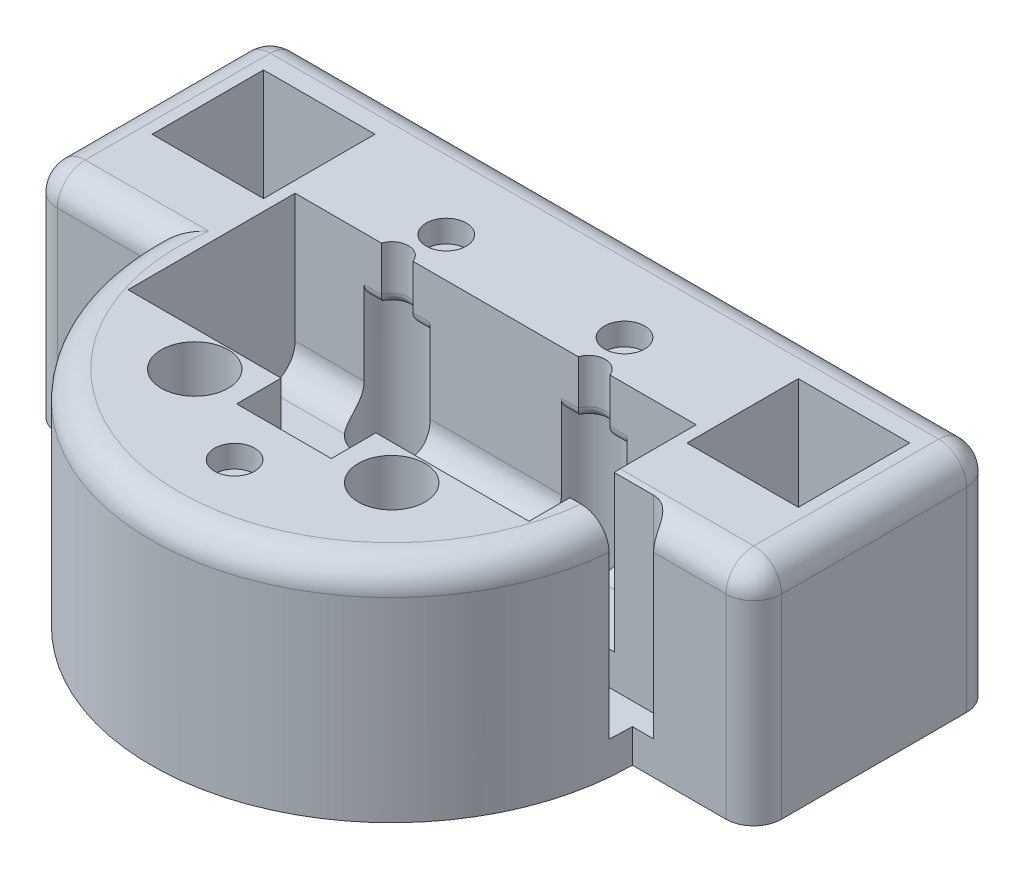
from build123d import *

# Parameters (mm, degrees)
SKETCH1_R           = 43.2
BOSS_EXTRUDE1_DEPTH = 40
SKETCH2_R           = 3
SKETCH2_W           = 20
SKETCH2_H           = 20
CUT_EXTRUDE1_DEPTH  = 50
SKETCH3_W           = 8.5
SKETCH3_H           = 8
SKETCH3_W_2         = 72
SKETCH3_H_2         = 30
CUT_EXTRUDE2_DEPTH  = 28
FILLET1_R           = 5
CUT_EXTRUDE3_START  = -34
SKETCH4_R           = 4
CUT_EXTRUDE3_DEPTH  = 34
SKETCH5_R           = 3.6
CUT_EXTRUDE4_DEPTH  = 4
FILLET3_R           = 5
SKETCH7_R           = 6
CUT_EXTRUDE5_DEPTH  = 36
CUT_EXTRUDE6_START  = -10
SKETCH8_R           = 6
SKETCH8_R_2         = 5.953171137
CUT_EXTRUDE6_DEPTH  = 26
FILLET4_R           = 2


with BuildPart() as part:
    # Sketch1 → Boss-Extrude1 (new body)
    with BuildSketch(Plane(origin=(0, 0, 0), x_dir=(1, 0, 0), z_dir=(0, 1, 0))):
        Circle(SKETCH1_R)
        with BuildLine():
            Line((0, 43.2), (-65, 43.2))
            Line((-65, 43.2), (-65, 0))
            Line((-65, 0), (-43.2, 0))
            ThreePointArc((-43.2, 0), (-30.547012947, 30.547012947), (0, 43.2))
        make_face()
        with BuildLine():
            Line((65, 43.2), (0, 43.2))
            ThreePointArc((0, 43.2), (30.547012947, 30.547012947), (43.2, 0))
            Line((43.2, 0), (65, 0))
            Line((65, 0), (65, 43.2))
        make_face()
    extrude(amount=BOSS_EXTRUDE1_DEPTH)

    # Sketch2 → Cut-Extrude1 (cut)
    with BuildSketch(Plane(origin=(0, 40, 0), x_dir=(1, 0, 0), z_dir=(0, 1, 0))):
        with Locations(Location((17.67766953, 17.67766953, 0), (0, 0, 270))):
            Circle(SKETCH2_R)
        with Locations(Location((17.67766953, -17.67766953, 0), (0, 0, 270))):
            Circle(SKETCH2_R)
        with Locations(Location((-17.67766953, -17.67766953, 0), (0, 0, 270))):
            Circle(SKETCH2_R)
        with Locations(Location((-17.67766953, 17.67766953, 0), (0, 0, 270))):
            Circle(SKETCH2_R)
        with Locations((48, 25)):
            Rectangle(SKETCH2_W, SKETCH2_H)
        with Locations((-48, 25)):
            Rectangle(SKETCH2_W, SKETCH2_H)
    extrude(amount=-CUT_EXTRUDE1_DEPTH, mode=Mode.SUBTRACT)

    # Sketch3 → Cut-Extrude2 (cut)
    with BuildSketch(Plane(origin=(0, 40, 0), x_dir=(1, 0, 0), z_dir=(0, 1, 0))):
        with Locations((4.25, -15.338834765)):
            Rectangle(SKETCH3_W, SKETCH3_H)
        with Locations((-4.25, -15.338834765)):
            Rectangle(SKETCH3_W, SKETCH3_H)
        with Locations((0, 3.661165235)):
            Rectangle(SKETCH3_W_2, SKETCH3_H_2)
    extrude(amount=-CUT_EXTRUDE2_DEPTH, mode=Mode.SUBTRACT)

    # Fillet1
    # the kernel refuses this fillet: 5 mm, written as the material it adds along each edge
    with BuildSketch(Plane(origin=(36, 12, -18.661165235), x_dir=(0, 1, 0), z_dir=(-1, 0, 0))) as fillet1_piece_1_section:
        with BuildLine():
            CenterArc((FILLET1_R, -FILLET1_R), FILLET1_R, 90, 90)
            Line((0, -FILLET1_R), (0, 0))
            Line((0, 0), (FILLET1_R, 0))
        make_face()
    fillet1_piece_1 = extrude(amount=27.988122257, mode=Mode.PRIVATE)
    fillet1_piece_1 = fillet1_piece_1 - Plane(origin=(17.67766953, 13.117889493, -17.67766953), x_dir=(0, 0, 1), z_dir=(0, 1, 0)) * Cylinder(3, 76, mode=Mode.PRIVATE)
    add(fillet1_piece_1)
    with BuildSketch(Plane(origin=(-8.011877743, 12, -18.661165235), x_dir=(0, 1, 0), z_dir=(-1, 0, 0))) as fillet1_piece_2_section:
        with BuildLine():
            CenterArc((FILLET1_R, -FILLET1_R), FILLET1_R, 90, 90)
            Line((0, -FILLET1_R), (0, 0))
            Line((0, 0), (FILLET1_R, 0))
        make_face()
    fillet1_piece_2 = extrude(amount=27.988122257, mode=Mode.PRIVATE)
    fillet1_piece_2 = fillet1_piece_2 - Plane(origin=(-17.67766953, 13.117890299, -17.67766953), x_dir=(0, 0, 1), z_dir=(0, 1, 0)) * Cylinder(3, 76, mode=Mode.PRIVATE)
    add(fillet1_piece_2)
    with BuildSketch(Plane(origin=(27.343461316, 12, -18.661165235), x_dir=(0, 1, 0), z_dir=(-1, 0, 0))) as fillet1_piece_3_section:
        with BuildLine():
            CenterArc((FILLET1_R, -FILLET1_R), FILLET1_R, 90, 90)
            Line((0, -FILLET1_R), (0, 0))
            Line((0, 0), (FILLET1_R, 0))
        make_face()
    fillet1_piece_3 = extrude(amount=54.686922632, mode=Mode.PRIVATE)
    fillet1_piece_3 = fillet1_piece_3 - Plane(origin=(-17.67766953, 13.117473799, -17.67766953), x_dir=(0, 0, 1), z_dir=(0, 1, 0)) * Cylinder(3, 130, mode=Mode.PRIVATE)
    fillet1_piece_3 = fillet1_piece_3 - Plane(origin=(17.67766953, 13.117473799, -17.67766953), x_dir=(0, 0, 1), z_dir=(0, 1, 0)) * Cylinder(3, 130, mode=Mode.PRIVATE)
    add(fillet1_piece_3)
    with BuildSketch(Plane(origin=(-36, 12, 11.338834765), x_dir=(0, 1, 0), z_dir=(1, 0, 0)), Plane(origin=(8.5, 12, 11.338834765), x_dir=(0, 1, 0), z_dir=(1, 0, 0))) as fillet1_piece_4:
        with BuildLine():
            CenterArc((FILLET1_R, -FILLET1_R), FILLET1_R, 90, 90)
            Line((0, -FILLET1_R), (0, 0))
            Line((0, 0), (FILLET1_R, 0))
        make_face()
    extrude(amount=27.5)

    # Sketch4 → Cut-Extrude3 (cut)
    with BuildSketch(Plane(origin=(0, 40, 0), x_dir=(1, 0, 0), z_dir=(0, 1, 0)).offset(CUT_EXTRUDE3_START)):
        with BuildLine():
            Line((43.014416188, 4), (36, 4))
            Line((36, 4), (36, -4))
            Line((36, -4), (43.014416188, -4))
            ThreePointArc((43.014416188, -4), (43.153579106, -2.002151427), (43.2, 0))
            Line((43.2, 0), (47.014416188, 0))
            ThreePointArc((47.014416188, 0), (45.842843313, 2.828427125), (43.014416188, 4))
        make_face()
        with BuildLine():
            Line((36, 4), (23.014416188, 4))
            ThreePointArc((23.014416188, 4), (25.842843313, 2.828427125), (27.014416188, 0))
            ThreePointArc((27.014416188, 0), (25.842843313, -2.828427125), (23.014416188, -4))
            Line((23.014416188, -4), (36, -4))
            Line((36, -4), (36, 4))
        make_face()
        with Locations((23.014416188, 0)):
            Circle(SKETCH4_R)
        with BuildLine():
            ThreePointArc((43.014416188, -4), (45.842843313, -2.828427125), (47.014416188, 0))
            Line((47.014416188, 0), (43.2, 0))
            ThreePointArc((43.2, 0), (43.153579106, -2.002151427), (43.014416188, -4))
        make_face()
    extrude(amount=CUT_EXTRUDE3_DEPTH, mode=Mode.SUBTRACT)

    # Sketch5 → Cut-Extrude4 (cut)
    with BuildSketch(Plane(origin=(0, 40, 0), x_dir=(1, 0, 0), z_dir=(0, 1, 0))):
        with Locations(Location((16, 25.8, 0), (0, 0, 270))):
            Circle(SKETCH5_R)
        with Locations(Location((-16, 25.8, 0), (0, 0, 270))):
            Circle(SKETCH5_R)
        with Locations(Location((0, -28.2, 0), (0, 0, 270))):
            Circle(SKETCH5_R)
    extrude(amount=-CUT_EXTRUDE4_DEPTH, mode=Mode.SUBTRACT)

    # Fillet3
    fillet3_edges = [part.edges().sort_by_distance(p)[0] for p in [
        (-2.002151427, 40, 43.153579106),
        (56.007208094, 40, 0),
        (-54.1, 40, 0),
        (-65, 40, -21.6),
        (65, 40, -21.6),
        (0, 40, -43.2),
        (65, 20, 0),
        (65, 20, -43.2),
        (-65, 20, -43.2),
        (-65, 20, 0),
    ]]
    fillet(fillet3_edges, radius=FILLET3_R)

    # Sketch7 → Cut-Extrude5 (cut)
    with BuildSketch(Plane(origin=(0, 40, 0), x_dir=(1, 0, 0), z_dir=(0, 1, 0))):
        with Locations(Location((17.67766953, -17.67766953, 0), (0, 0, 270))):
            Circle(SKETCH7_R)
        with Locations(Location((-17.67766953, -17.67766953, 0), (0, 0, 270))):
            Circle(SKETCH7_R)
    extrude(amount=-CUT_EXTRUDE5_DEPTH, mode=Mode.SUBTRACT)

    # Sketch8 → Cut-Extrude6 (cut)
    with BuildSketch(Plane(origin=(0, 40, 0), x_dir=(1, 0, 0), z_dir=(0, 1, 0)).offset(CUT_EXTRUDE6_START)):
        with Locations(Location((-17.67766953, 17.67766953, 0), (0, 0, 270))):
            Circle(SKETCH8_R)
        with Locations(Location((17.67766953, 17.67766953, 0), (0, 0, 270))):
            Circle(SKETCH8_R_2)
    extrude(amount=-CUT_EXTRUDE6_DEPTH, mode=Mode.SUBTRACT)

    # Fillet4
    fillet4_edges = [part.edges().sort_by_distance(p)[0] for p in [
        (-22.054196561, 30, -18.661165235),
        (13.324880546, 30, -18.661165235),
        (-13.301142498, 30, -18.661165235),
        (-17.677669692, 30, -20.67766953),
        (22.030458513, 30, -18.661165235),
        (17.677669367, 30, -20.67766953),
    ]]
    fillet(fillet4_edges, radius=FILLET4_R)


solid = part.part
